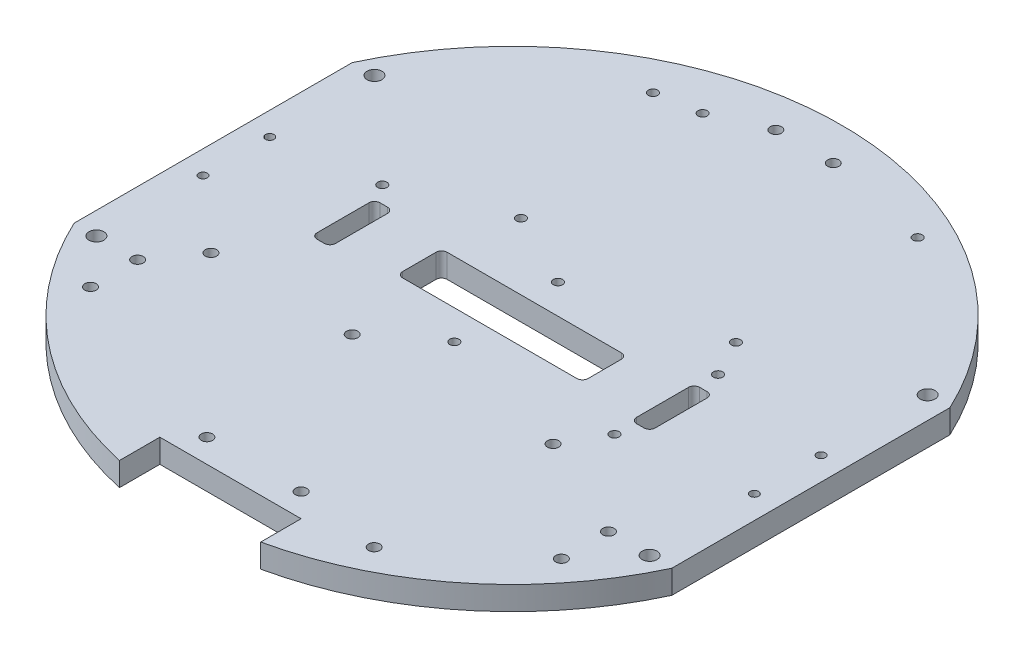
from build123d import *

# Parameters (mm, degrees)
MAIN_BODY_DEPTH             = 6.35
RASPBERRY_PI_REACH          = 122.169
SKETCH2_R                   = 1.25
MOTOR_MOUNTS_REACH          = 122.169
SKETCH3_R                   = 1.143
CASTER_REACH                = 122.169
SKETCH4_R                   = 1.524
SKETCH5_R                   = 1.524
GRABBER_MOUNT_DEPTH         = 121.168600308
SKETCH6_R                   = 1.524
FRONT_IR_DEPTH              = 121.168600308
SKETCH8_R                   = 1.524
SIDE_IR_DEPTH               = 121.168600308
SKETCH9_R                   = 1.524
PIXY_MOUNT_DEPTH            = 121.168600308
SKETCH10_W                  = 38.1
SKETCH10_H                  = 25.908
GRABBER_SLOT_DEPTH          = 121.168600308
SKETCH11_W                  = 5
SKETCH11_H                  = 17
SKETCH11_W_2                = 50
SKETCH11_H_2                = 12
WIRE_SLOTS_DEPTH            = 121.168600308
SKETCH13_R                  = 2
F_2ND_LEVEL_STANDOFFS_DEPTH = 121.168600308
FILLET1_R                   = 1.5
SKETCH14_R                  = 1.25
ENCODER_PERFBOARD_DEPTH     = 10
SKETCH15_R                  = 1.25
DECODER_IC_DEPTH            = 10


with BuildPart() as part:
    # Sketch1 → Main Body (new body)
    with BuildSketch(Plane(origin=(0, 0, 0), x_dir=(1, 0, 0), z_dir=(0, 1, 0))):
        with BuildLine():
            Line((-80.603721998, 37.5), (-80.603721998, -37.5))
            ThreePointArc((-80.603721998, -37.5), (0, -88.9), (80.603721998, -37.5))
            Line((80.603721998, -37.5), (80.603721998, 37.5))
            ThreePointArc((80.603721998, 37.5), (0, 88.9), (-80.603721998, 37.5))
        make_face()
    extrude(amount=MAIN_BODY_DEPTH)

    # Sketch2 → Raspberry Pi (cut, up to next)
    with BuildSketch(Plane(origin=(0, 6.35, 0), x_dir=(1, 0, 0), z_dir=(0, 1, 0)), mode=Mode.PRIVATE) as raspberry_pi_sk1:
        with Locations((36.5, 72.9)):
            Circle(SKETCH2_R)
    raspberry_pi_tool1 = extrude(raspberry_pi_sk1.sketch, amount=-RASPBERRY_PI_REACH, mode=Mode.PRIVATE) & part.part
    # Sketch2 → Raspberry Pi (cut, up to next)
    with BuildSketch(Plane(origin=(0, 6.35, 0), x_dir=(1, 0, 0), z_dir=(0, 1, 0)), mode=Mode.PRIVATE) as raspberry_pi_sk2:
        with Locations((36.5, 23.9)):
            Circle(SKETCH2_R)
    raspberry_pi_tool2 = extrude(raspberry_pi_sk2.sketch, amount=-RASPBERRY_PI_REACH, mode=Mode.PRIVATE) & part.part
    # Sketch2 → Raspberry Pi (cut, up to next)
    with BuildSketch(Plane(origin=(0, 6.35, 0), x_dir=(1, 0, 0), z_dir=(0, 1, 0)), mode=Mode.PRIVATE) as raspberry_pi_sk3:
        with Locations((-21.5, 23.9)):
            Circle(SKETCH2_R)
    raspberry_pi_tool3 = extrude(raspberry_pi_sk3.sketch, amount=-RASPBERRY_PI_REACH, mode=Mode.PRIVATE) & part.part
    # Sketch2 → Raspberry Pi (cut, up to next)
    with BuildSketch(Plane(origin=(0, 6.35, 0), x_dir=(1, 0, 0), z_dir=(0, 1, 0)), mode=Mode.PRIVATE) as raspberry_pi_sk4:
        with Locations((-21.5, 72.9)):
            Circle(SKETCH2_R)
    raspberry_pi_tool4 = extrude(raspberry_pi_sk4.sketch, amount=-RASPBERRY_PI_REACH, mode=Mode.PRIVATE) & part.part
    add(raspberry_pi_tool1.solids().sort_by_distance((36.5, 6.35, -72.9))[0], mode=Mode.SUBTRACT)
    add(raspberry_pi_tool2.solids().sort_by_distance((36.5, 6.35, -23.9))[0], mode=Mode.SUBTRACT)
    add(raspberry_pi_tool3.solids().sort_by_distance((-21.5, 6.35, -23.9))[0], mode=Mode.SUBTRACT)
    add(raspberry_pi_tool4.solids().sort_by_distance((-21.5, 6.35, -72.9))[0], mode=Mode.SUBTRACT)

    # Sketch3 → Motor Mounts (cut, up to next)
    with BuildSketch(Plane(origin=(0, 6.35, 0), x_dir=(1, 0, 0), z_dir=(0, 1, 0)), mode=Mode.PRIVATE) as motor_mounts_sk1:
        with Locations((-74.353721998, 9)):
            Circle(SKETCH3_R)
    motor_mounts_tool1 = extrude(motor_mounts_sk1.sketch, amount=-MOTOR_MOUNTS_REACH, mode=Mode.PRIVATE) & part.part
    # Sketch3 → Motor Mounts (cut, up to next)
    with BuildSketch(Plane(origin=(0, 6.35, 0), x_dir=(1, 0, 0), z_dir=(0, 1, 0)), mode=Mode.PRIVATE) as motor_mounts_sk2:
        with Locations((-74.353721998, -9)):
            Circle(SKETCH3_R)
    motor_mounts_tool2 = extrude(motor_mounts_sk2.sketch, amount=-MOTOR_MOUNTS_REACH, mode=Mode.PRIVATE) & part.part
    # Sketch3 → Motor Mounts (cut, up to next)
    with BuildSketch(Plane(origin=(0, 6.35, 0), x_dir=(1, 0, 0), z_dir=(0, 1, 0)), mode=Mode.PRIVATE) as motor_mounts_sk3:
        with Locations((74.353721998, 9)):
            Circle(SKETCH3_R)
    motor_mounts_tool3 = extrude(motor_mounts_sk3.sketch, amount=-MOTOR_MOUNTS_REACH, mode=Mode.PRIVATE) & part.part
    # Sketch3 → Motor Mounts (cut, up to next)
    with BuildSketch(Plane(origin=(0, 6.35, 0), x_dir=(1, 0, 0), z_dir=(0, 1, 0)), mode=Mode.PRIVATE) as motor_mounts_sk4:
        with Locations((74.353721998, -9)):
            Circle(SKETCH3_R)
    motor_mounts_tool4 = extrude(motor_mounts_sk4.sketch, amount=-MOTOR_MOUNTS_REACH, mode=Mode.PRIVATE) & part.part
    add(motor_mounts_tool1.solids().sort_by_distance((-74.353722, 6.35, -9))[0], mode=Mode.SUBTRACT)
    add(motor_mounts_tool2.solids().sort_by_distance((-74.353722, 6.35, 9))[0], mode=Mode.SUBTRACT)
    add(motor_mounts_tool3.solids().sort_by_distance((74.353722, 6.35, -9))[0], mode=Mode.SUBTRACT)
    add(motor_mounts_tool4.solids().sort_by_distance((74.353722, 6.35, 9))[0], mode=Mode.SUBTRACT)

    # Sketch4 → Caster (cut, up to next)
    with BuildSketch(Plane(origin=(0, 6.35, 0), x_dir=(1, 0, 0), z_dir=(0, 1, 0)), mode=Mode.PRIVATE) as caster_sk1:
        with Locations((-7.747, 78.9)):
            Circle(SKETCH4_R)
    caster_tool1 = extrude(caster_sk1.sketch, amount=-CASTER_REACH, mode=Mode.PRIVATE) & part.part
    # Sketch4 → Caster (cut, up to next)
    with BuildSketch(Plane(origin=(0, 6.35, 0), x_dir=(1, 0, 0), z_dir=(0, 1, 0)), mode=Mode.PRIVATE) as caster_sk2:
        with Locations((7.747, 78.9)):
            Circle(SKETCH4_R)
    caster_tool2 = extrude(caster_sk2.sketch, amount=-CASTER_REACH, mode=Mode.PRIVATE) & part.part
    add(caster_tool1.solids().sort_by_distance((-7.747, 6.35, -78.9))[0], mode=Mode.SUBTRACT)
    add(caster_tool2.solids().sort_by_distance((7.747, 6.35, -78.9))[0], mode=Mode.SUBTRACT)

    # Sketch5 → Grabber Mount (cut, through all)
    with BuildSketch(Plane(origin=(0, 6.35, 0), x_dir=(1, 0, 0), z_dir=(0, 1, 0))):
        with Locations((35.56, -24.48608666)):
            Circle(SKETCH5_R)
        with Locations((35.56, -72.74608666)):
            Circle(SKETCH5_R)
    extrude(amount=-GRABBER_MOUNT_DEPTH, mode=Mode.SUBTRACT)

    # Sketch6 → Front IR (cut, through all)
    with BuildSketch(Plane(origin=(0, 6.35, 0), x_dir=(1, 0, 0), z_dir=(0, 1, 0))):
        with Locations((-12.7, -69.596)):
            Circle(SKETCH6_R)
        with Locations((12.7, -69.596)):
            Circle(SKETCH6_R)
    extrude(amount=-FRONT_IR_DEPTH, mode=Mode.SUBTRACT)

    # Sketch8 → Side IR (cut, through all)
    with BuildSketch(Plane(origin=(0, 6.35, 0), x_dir=(1, 0, 0), z_dir=(0, 1, 0))):
        with Locations((-63.5, -37.5)):
            Circle(SKETCH8_R)
        with Locations((-63.5, -50.2)):
            Circle(SKETCH8_R)
        with Locations((63.5, -50.2)):
            Circle(SKETCH8_R)
        with Locations((63.5, -37.5)):
            Circle(SKETCH8_R)
    extrude(amount=-SIDE_IR_DEPTH, mode=Mode.SUBTRACT)

    # Sketch9 → Pixy Mount (cut, through all)
    with BuildSketch(Plane(origin=(0, 6.35, 0), x_dir=(1, 0, 0), z_dir=(0, 1, 0))):
        with Locations((-55.203721998, -26.01008666)):
            Circle(SKETCH9_R)
        with Locations((-17.103721998, -26.01008666)):
            Circle(SKETCH9_R)
    extrude(amount=-PIXY_MOUNT_DEPTH, mode=Mode.SUBTRACT)

    # Sketch10 → Grabber slot (cut, through all)
    with BuildSketch(Plane(origin=(0, 6.35, 0), x_dir=(1, 0, 0), z_dir=(0, 1, 0))):
        with Locations((0, -88.9)):
            Rectangle(SKETCH10_W, SKETCH10_H)
    extrude(amount=-GRABBER_SLOT_DEPTH, mode=Mode.SUBTRACT)

    # Sketch11 → Wire slots (cut, through all)
    with BuildSketch(Plane(origin=(0, 6.35, 0), x_dir=(1, 0, 0), z_dir=(0, 1, 0))):
        with Locations((-43.103721998, 0)):
            Rectangle(SKETCH11_W, SKETCH11_H)
        Rectangle(SKETCH11_W_2, SKETCH11_H_2)
        with Locations((43.103721998, 0)):
            Rectangle(SKETCH11_W, SKETCH11_H)
    extrude(amount=-WIRE_SLOTS_DEPTH, mode=Mode.SUBTRACT)

    # Sketch13 → 2nd level standoffs (cut, through all)
    with BuildSketch(Plane(origin=(0, 6.35, 0), x_dir=(1, 0, 0), z_dir=(0, 1, 0))):
        with Locations((74.603721998, -37.5)):
            Circle(SKETCH13_R)
        with Locations((-74.603721998, -37.5)):
            Circle(SKETCH13_R)
        with Locations((74.603721998, 37.5)):
            Circle(SKETCH13_R)
        with Locations((-74.603721998, 37.5)):
            Circle(SKETCH13_R)
    extrude(amount=-F_2ND_LEVEL_STANDOFFS_DEPTH, mode=Mode.SUBTRACT)

    # Fillet1
    fillet1_edges = [part.edges().sort_by_distance(p)[0] for p in [
        (40.603721998, 3.175, -8.5),
        (40.603721998, 3.175, 8.5),
        (45.603721998, 3.175, 8.5),
        (45.603721998, 3.175, -8.5),
        (-45.603721998, 3.175, 8.5),
        (-40.603721998, 3.175, 8.5),
        (-45.603721998, 3.175, -8.5),
        (-40.603721998, 3.175, -8.5),
        (-25, 3.175, 6),
        (-25, 3.175, -6),
        (25, 3.175, 6),
        (25, 3.175, -6),
    ]]
    fillet(fillet1_edges, radius=FILLET1_R)

    # Sketch14 → Encoder Perfboard (cut)
    with BuildSketch(Plane(origin=(0, 6.35, 0), x_dir=(1, 0, 0), z_dir=(0, 1, 0))):
        with Locations((-1.59, 13.97)):
            Circle(SKETCH14_R)
        with Locations((41.59, 13.97)):
            Circle(SKETCH14_R)
        with Locations((41.59, -13.97)):
            Circle(SKETCH14_R)
        with Locations((-1.59, -13.97)):
            Circle(SKETCH14_R)
    extrude(amount=-ENCODER_PERFBOARD_DEPTH, mode=Mode.SUBTRACT)

    # Sketch15 → decoder ic (cut)
    with BuildSketch(Plane(origin=(0, 6.35, 0), x_dir=(1, 0, 0), z_dir=(0, 1, 0))):
        with Locations((-48, 13)):
            Circle(SKETCH15_R)
        with Locations((-33, 71)):
            Circle(SKETCH15_R)
    extrude(amount=-DECODER_IC_DEPTH, mode=Mode.SUBTRACT)


solid = part.part
